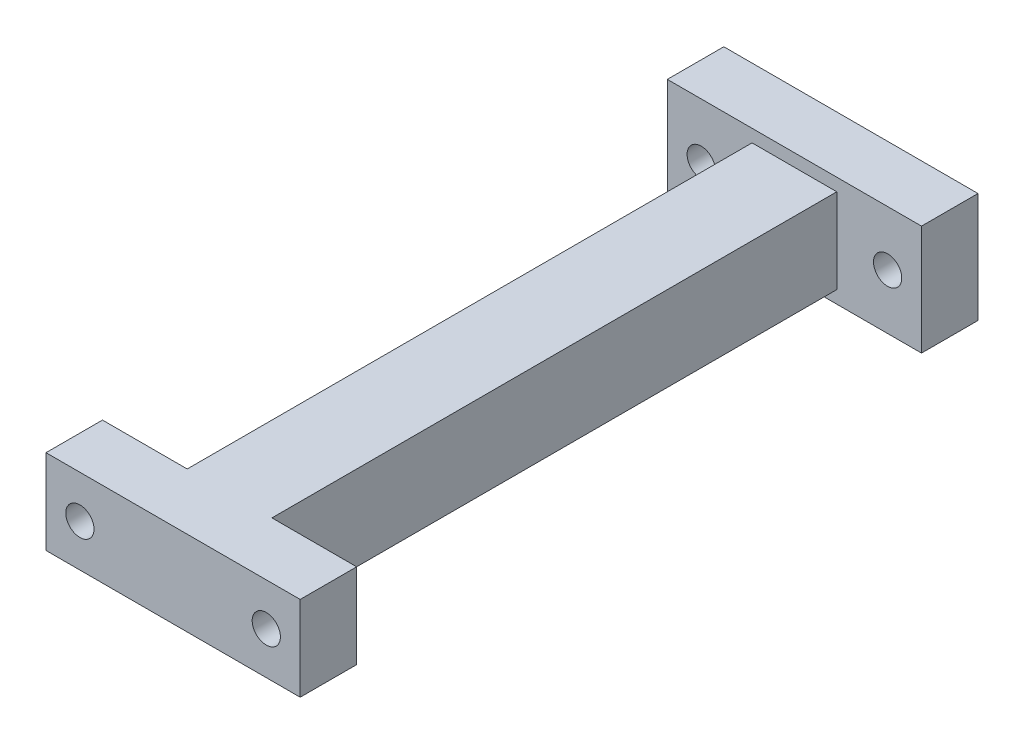
from build123d import *

# Parameters (mm, degrees)
SKETCH_1_W          = 15
SKETCH_1_H          = 15
EXTRUDE_1_DEPTH     = 120
SKETCH_2_W          = 45
SKETCH_2_H          = 15
EXTRUDE_2_DEPTH     = 10
SKETCH_3_R          = 2.5
CUT_EXTRUDE_1_DEPTH = 20
SKETCH_5_W          = 45
SKETCH_5_H          = 19.472765692
EXTRUDE_3_DEPTH     = 10
SKETCH_6_R          = 2.5
CUT_EXTRUDE_2_DEPTH = 123.47876204


with BuildPart() as part:
    # 草图1 → 凸台-拉伸1 (new body)
    with BuildSketch(Plane.XY):
        Rectangle(SKETCH_1_W, SKETCH_1_H)
    extrude(amount=EXTRUDE_1_DEPTH)

    # 草图2 → 凸台-拉伸2 (add)
    with BuildSketch(Plane.XY.offset(120)):
        Rectangle(SKETCH_2_W, SKETCH_2_H)
    extrude(amount=-EXTRUDE_2_DEPTH)

    # 草图3 → 切除-拉伸1 (cut)
    with BuildSketch(Plane.XY.offset(120)):
        with Locations((-16.5, 0)):
            Circle(SKETCH_3_R)
        with Locations((16.5, 0)):
            Circle(SKETCH_3_R)
    extrude(amount=-CUT_EXTRUDE_1_DEPTH, mode=Mode.SUBTRACT)

    # 草图5 → 凸台-拉伸3 (add)
    with BuildSketch(Plane(origin=(0, 0, 0), x_dir=(-1, 0, 0), z_dir=(0, 0, -1))):
        Rectangle(SKETCH_5_W, SKETCH_5_H)
    extrude(amount=-EXTRUDE_3_DEPTH)

    # 草图6 → 切除-拉伸2 (cut, through all)
    with BuildSketch(Plane(origin=(0, 0, 0), x_dir=(-1, 0, 0), z_dir=(0, 0, -1))):
        with Locations((-16.5, 0)):
            Circle(SKETCH_6_R)
        with Locations((16.5, 0)):
            Circle(SKETCH_6_R)
    extrude(amount=-CUT_EXTRUDE_2_DEPTH, mode=Mode.SUBTRACT)


solid = part.part
